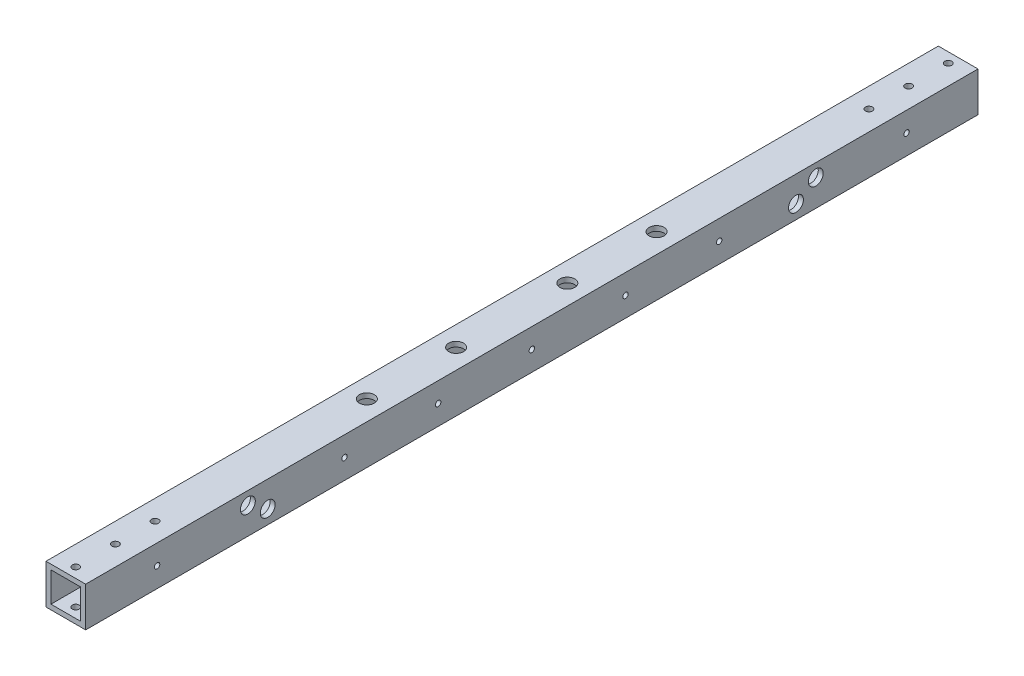
from build123d import *

# Parameters (mm, degrees)
SKETCH1_W                    = 25.4
SKETCH1_H                    = 25.4
SKETCH1_W_2                  = 19.05
SKETCH1_H_2                  = 19.05
EXTRUDE_THIN1_DEPTH          = 571.5
F_8_CLEARANCE_HOLE1_D        = 4.4958
F_8_32_TAPPED_HOLE1_D        = 3.4544
F_8_32_TAPPED_HOLE1_DEPTH    = 12.2936
F_8_32_TAPPED_HOLE1_TIP      = 1.037806461
F_3_8_0_375_DIAMETER_HOLE2_D = 9.525
F_3_8_0_375_DIAMETER_HOLE3_D = 9.525


with BuildPart() as part:
    # Sketch1 → Extrude-Thin1 (new body)
    with BuildSketch(Plane.XY):
        Rectangle(SKETCH1_W, SKETCH1_H)
        Rectangle(SKETCH1_W_2, SKETCH1_H_2, mode=Mode.SUBTRACT)
    extrude(amount=EXTRUDE_THIN1_DEPTH)

    # #8 Clearance Hole1 (through all)
    with Locations(Plane(origin=(0, 12.7, 565.15), x_dir=(0, 0, 1), z_dir=(0, 1, 0))):
        with Locations((0, 0), (-558.8, 0), (-533.4, 0), (-508, 0), (-25.4, 0), (-50.8, 0)):
            Hole(F_8_CLEARANCE_HOLE1_D / 2)

    # #8-32 Tapped Hole1
    with Locations(Plane(origin=(12.7, -82.55, 285.75), x_dir=(0, 0, -1), z_dir=(1, 0, 0))):
        with Locations((-240, 82.55), (-120, 82.55), (-60, 82.55), (0, 82.55), (60, 82.55), (120, 82.55), (240, 82.55)):
            Hole(F_8_32_TAPPED_HOLE1_D / 2, depth=F_8_32_TAPPED_HOLE1_DEPTH)
            with Locations((0, 0, -(F_8_32_TAPPED_HOLE1_DEPTH + F_8_32_TAPPED_HOLE1_TIP / 2))):  # 118° drill point
                Cone(0, F_8_32_TAPPED_HOLE1_D / 2, F_8_32_TAPPED_HOLE1_TIP, mode=Mode.SUBTRACT)

    # 3/8 (0.375) Diameter Hole2 (through all)
    with Locations(Plane(origin=(-12.7, -82.55, 285.75), x_dir=(0, 0, -1), z_dir=(-1, 0, 0))):
        with Locations((-181.864, -86.995), (-169.164, -78.74), (169.164, -78.74), (181.864, -86.995), (181.864, -57.15), (-181.864, -57.15)):
            Hole(F_3_8_0_375_DIAMETER_HOLE2_D / 2)

    # 3/8 (0.375) Diameter Hole3 (through all)
    with Locations(Plane(origin=(-346.075, 12.7, 285.75), x_dir=(0, 0, 1), z_dir=(0, 1, 0))):
        with Locations((-92.583, 346.075), (-35.433, 346.075), (35.814, 346.075), (92.964, 346.075), (-19.05, -346.775), (53.975, -346.775), (127, -346.775), (-381, -114.3), (-381, -130.175), (-381, -146.05), (-381, 114.3), (-381, 98.425), (-381, 82.55)):
            Hole(F_3_8_0_375_DIAMETER_HOLE3_D / 2)


solid = part.part
